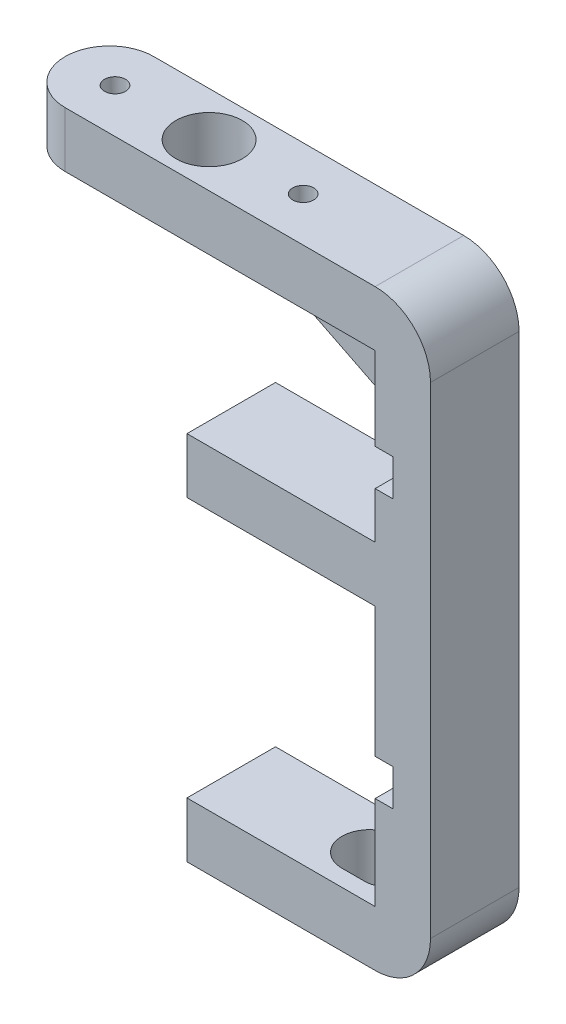
from build123d import *

# Parameters (mm, degrees)
P_IDAT_VYSUNUT_M1_DEPTH  = 4
SKICA2_W                 = 5
SKICA2_H                 = 8
P_IDAT_VYSUNUT_M2_DEPTH  = 20
SKICA3_W                 = 8
SKICA3_H                 = 5
P_IDAT_VYSUNUT_M3_DEPTH  = 32
P_IDAT_VYSUNUT_M4_DEPTH  = 2.5
SKICA5_R                 = 3
ODEBRAT_VYSUNUT_M1_DEPTH = 15
ZAOBLIT1_R               = 5
SKICA6_R                 = 1.2
ODEBRAT_VYSUNUT_M2_DEPTH = 8
ZAOBLIT2_R               = 4
SKICA7_R                 = 0.95
ODEBRAT_VYSUNUT_M3_DEPTH = 13
ODEBRAT_VYSUNUT_M4_DEPTH = 10
SKICA9_W                 = 1.6
SKICA9_H                 = 3.3
ODEBRAT_VYSUNUT_M5_DEPTH = 10


with BuildPart() as part:
    # Skica1 → Přidat vysunutím1 (new, symmetric)
    with BuildSketch(Plane.XY):
        Polygon((0, 0), (17, 0), (17, 23.5), (0, 23.5), (0, 28.5), (22, 28.5), (22, -5), (0, -5), align=None)
    extrude(amount=P_IDAT_VYSUNUT_M1_DEPTH, both=True)

    # Skica2 → Přidat vysunutím2 (add)
    with BuildSketch(Plane(origin=(0, 28.5, 0), x_dir=(1, 0, 0), z_dir=(0, 1, 0))):
        with Locations((19.5, 0)):
            Rectangle(SKICA2_W, SKICA2_H)
    extrude(amount=P_IDAT_VYSUNUT_M2_DEPTH)

    # Skica3 → Přidat vysunutím3 (add)
    with BuildSketch(Plane.ZY.offset(-17)):
        with Locations((0, 46)):
            Rectangle(SKICA3_W, SKICA3_H)
    extrude(amount=P_IDAT_VYSUNUT_M3_DEPTH)

    # Skica4 → Přidat vysunutím4 (add, symmetric)
    with BuildSketch(Plane.XY):
        Polygon((17, 43.5), (7, 43.5), (17, 38.5), align=None)
    extrude(amount=P_IDAT_VYSUNUT_M4_DEPTH, both=True)

    # Skica5 → Odebrat vysunutím1 (cut)
    with BuildSketch(Plane(origin=(0, 48.5, 0), x_dir=(1, 0, 0), z_dir=(0, 1, 0))):
        with Locations(Location((-2, 0, 0), (0, 0, 270))):
            Circle(SKICA5_R)
    extrude(amount=-ODEBRAT_VYSUNUT_M1_DEPTH, mode=Mode.SUBTRACT)

    # Zaoblit1
    zaoblit1_edges = [part.edges().sort_by_distance(p)[0] for p in [
        (22, -5, 0),
        (22, 48.5, 0),
    ]]
    fillet(zaoblit1_edges, radius=ZAOBLIT1_R)

    # Skica6 → Odebrat vysunutím2 (cut)
    with BuildSketch(Plane.ZY):
        with Locations((-6.1415e-05, 25.09368658)):
            Circle(SKICA6_R)
        with Locations((-5.8558e-05, -1.893787552)):
            Circle(SKICA6_R)
    extrude(amount=-ODEBRAT_VYSUNUT_M2_DEPTH, mode=Mode.SUBTRACT)

    # Zaoblit2
    zaoblit2_edges = [part.edges().sort_by_distance(p)[0] for p in [
        (-15, 46, -4),
        (-15, 46, 4),
    ]]
    fillet(zaoblit2_edges, radius=ZAOBLIT2_R - 0.0001)  # a hair under: the kernel refuses the full size

    # Skica7 → Odebrat vysunutím3 (cut)
    with BuildSketch(Plane(origin=(0, 48.5, 0), x_dir=(1, 0, 0), z_dir=(0, 1, 0))):
        with Locations(Location((-10.5, 0, 0), (0, 0, 270))):
            Circle(SKICA7_R)
        with Locations(Location((6.5, 0, 0), (0, 0, 270))):
            Circle(SKICA7_R)
    extrude(amount=-ODEBRAT_VYSUNUT_M3_DEPTH, mode=Mode.SUBTRACT)

    # Skica8 → Odebrat vysunutím4 (cut)
    with BuildSketch(Plane(origin=(0, 0, 0), x_dir=(1, 0, 0), z_dir=(0, 1, 0))):
        with BuildLine():
            Line((12.5, 2.5), (14.5, 2.5))
            ThreePointArc((14.5, 2.5), (17, 0), (14.5, -2.5))
            Line((14.5, -2.5), (12.5, -2.5))
            ThreePointArc((12.5, -2.5), (10, 0), (12.5, 2.5))
        make_face()
    extrude(amount=-ODEBRAT_VYSUNUT_M4_DEPTH, mode=Mode.SUBTRACT)

    # Skica9 → Odebrat vysunutím5 (cut)
    with BuildSketch(Plane.XY.offset(4)):
        with Locations((17.8, 34.35)):
            Rectangle(SKICA9_W, SKICA9_H)
        with Locations((17.8, 10.1)):
            Rectangle(SKICA9_W, SKICA9_H)
    extrude(amount=-ODEBRAT_VYSUNUT_M5_DEPTH, mode=Mode.SUBTRACT)


solid = part.part
